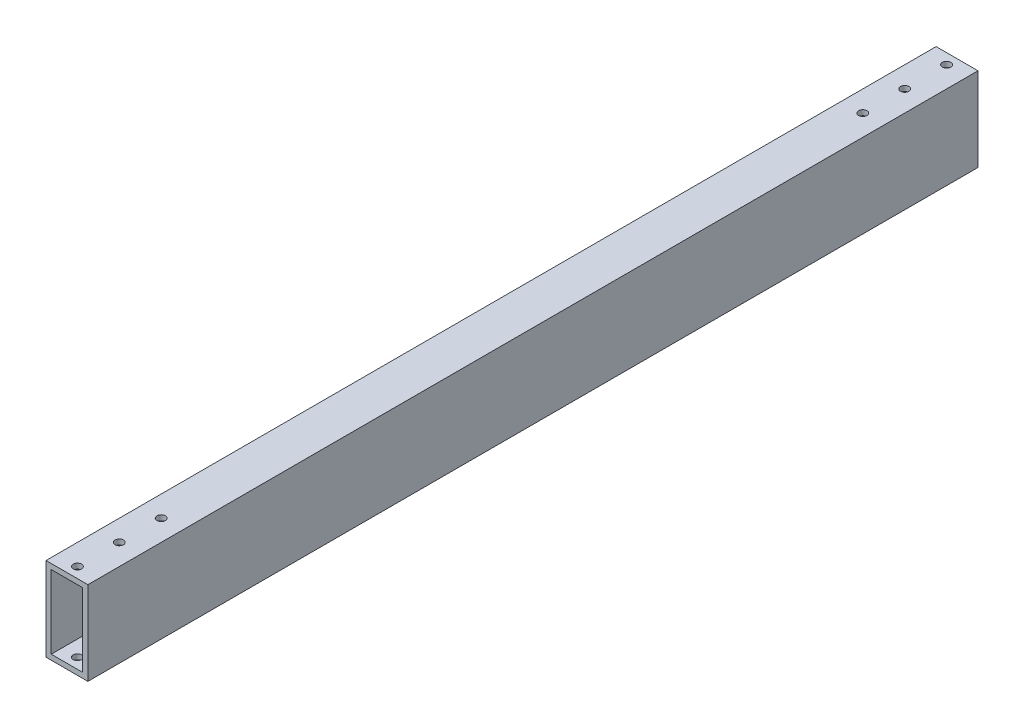
from build123d import *

# Parameters (mm, degrees)
SKETCH1_W              = 25.4
SKETCH1_H              = 50.8
SKETCH1_W_2            = 19.05
SKETCH1_H_2            = 44.45
EXTRUDE_THIN1_DEPTH    = 539.75
F_10_CLEARANCE_HOLE1_D = 5.1054


with BuildPart() as part:
    # Sketch1 → Extrude-Thin1 (new body)
    with BuildSketch(Plane.XY):
        Rectangle(SKETCH1_W, SKETCH1_H)
        Rectangle(SKETCH1_W_2, SKETCH1_H_2, mode=Mode.SUBTRACT)
    extrude(amount=EXTRUDE_THIN1_DEPTH)

    # #10 Clearance Hole1 (through all)
    with Locations(Plane(origin=(0, 25.4, 0), x_dir=(1, 0, 0), z_dir=(0, 1, 0))):
        with Locations((0, -533.4), (0, -508), (0, -482.6), (0, -6.35), (0, -31.75), (0, -57.15)):
            Hole(F_10_CLEARANCE_HOLE1_D / 2)


solid = part.part
